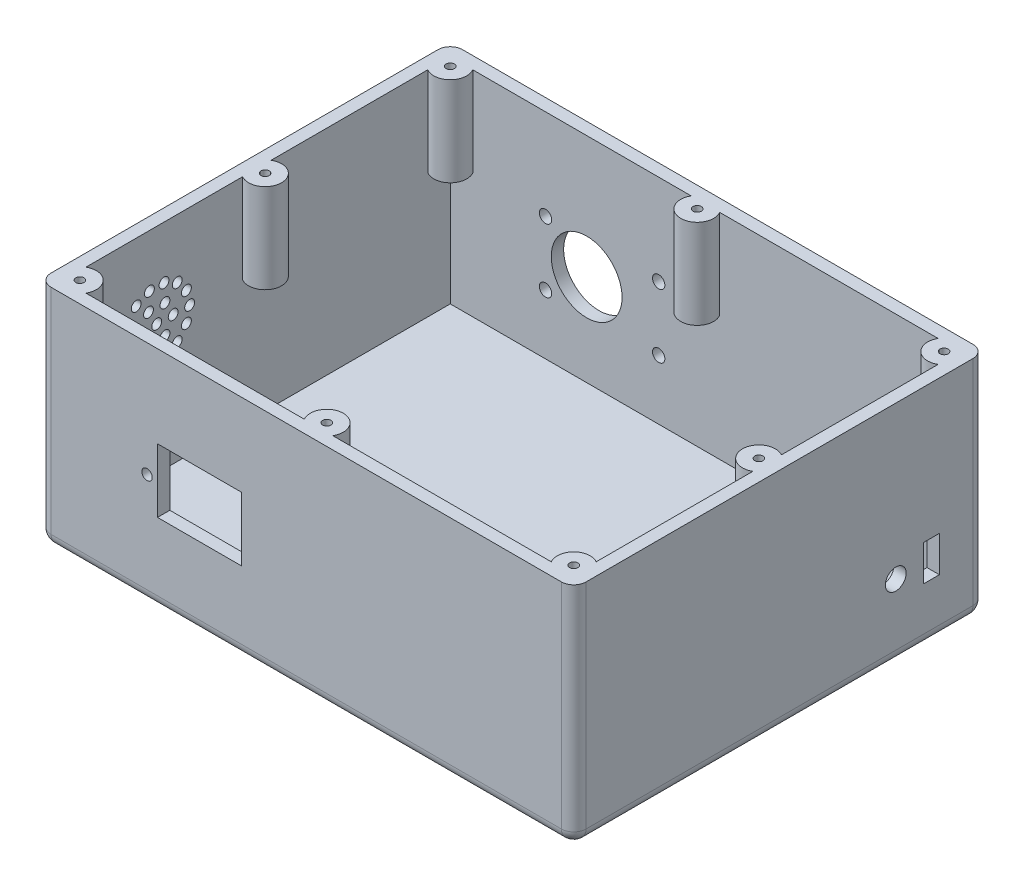
from build123d import *

# Parameters (mm, degrees)
SKETCH1_W                 = 130
SKETCH1_H                 = 100
BOSS_EXTRUDE1_DEPTH       = 55
F_1_0MM_DOWEL_HOLE1_D     = 2
F_1_0MM_DOWEL_HOLE1_DEPTH = 20
F_1_0MM_DOWEL_HOLE1_TIP   = 0.600860619
SHELL1_START              = 3
SHELL1_DEPTH              = 52
SHELL1_2_DEPTH            = 30.302681665
SKETCH4_R                 = 1.27
SKETCH4_W                 = 20.4
SKETCH4_H                 = 15.5
CUT_EXTRUDE1_DEPTH        = 10
SKETCH5_R                 = 8.6
SKETCH5_R_2               = 1.5
CUT_EXTRUDE5_DEPTH        = 10
SKETCH8_W                 = 3.9
SKETCH8_H                 = 8.7
CUT_EXTRUDE7_DEPTH        = 10
SKETCH13_R                = 2.53
CUT_EXTRUDE10_DEPTH       = 10
SKETCH15_R                = 1.2
CUT_EXTRUDE11_DEPTH       = 10
FILL_START                = -65
FILL_PATTERN1_OUTLINE_R   = 1.2
FILL_PATTERN1_DEPTH       = 3
FILLET3_R                 = 3


with BuildPart() as part:
    # Sketch1 → Boss-Extrude1 (new body)
    with BuildSketch(Plane(origin=(0, 0, 0), x_dir=(1, 0, 0), z_dir=(0, 1, 0))):
        Rectangle(SKETCH1_W, SKETCH1_H)
    extrude(amount=BOSS_EXTRUDE1_DEPTH)

    # Ø1.0mm Dowel Hole1
    with Locations(Plane(origin=(-60, 55, -45), x_dir=(0, 0, 1), z_dir=(0, 1, 0))):
        with Locations((0, 0), (45, 0), (90, 0), (90, 60), (90, 120), (45, 120), (0, 120), (0, 60)):
            Hole(F_1_0MM_DOWEL_HOLE1_D / 2, depth=F_1_0MM_DOWEL_HOLE1_DEPTH)
            with Locations((0, 0, -(F_1_0MM_DOWEL_HOLE1_DEPTH + F_1_0MM_DOWEL_HOLE1_TIP / 2))):  # 118° drill point
                Cone(0, F_1_0MM_DOWEL_HOLE1_D / 2, F_1_0MM_DOWEL_HOLE1_TIP, mode=Mode.SUBTRACT)

    # Shell1: read off the stored shape, not the designer's step
    # Shell1 outline → Shell1 (cut)
    with BuildSketch(Plane(origin=(0, 0, 0), x_dir=(1, 0, 0), z_dir=(0, 1, 0)).offset(SHELL1_START)):
        with BuildLine():
            Line((62, 3.464101615), (62, 41.535898385))
            ThreePointArc((62, 41.535898385), (57.171572875, 42.171572875), (56.535898385, 47))
            Line((56.535898385, 47), (3.464101615, 47))
            ThreePointArc((3.464101615, 47), (0, 41), (-3.464101615, 47))
            Line((-3.464101615, 47), (-56.535898385, 47))
            ThreePointArc((-56.535898385, 47), (-57.171572875, 42.171572875), (-62, 41.535898385))
            Line((-62, 41.535898385), (-62, 3.464101615))
            ThreePointArc((-62, 3.464101615), (-56, 0), (-62, -3.464101615))
            Line((-62, -3.464101615), (-62, -41.535898385))
            ThreePointArc((-62, -41.535898385), (-57.171572875, -42.171572875), (-56.535898385, -47))
            Line((-56.535898385, -47), (-3.464101615, -47))
            ThreePointArc((-3.464101615, -47), (0, -41), (3.464101615, -47))
            Line((3.464101615, -47), (56.535898385, -47))
            ThreePointArc((56.535898385, -47), (57.171572875, -42.171572875), (62, -41.535898385))
            Line((62, -41.535898385), (62, -3.464101615))
            ThreePointArc((62, -3.464101615), (56, 0), (62, 3.464101615))
        make_face()
    extrude(amount=SHELL1_DEPTH, mode=Mode.SUBTRACT)

    # Shell1 2 outline → Shell1 2 (cut)
    with BuildSketch(Plane(origin=(0, 0, 0), x_dir=(1, 0, 0), z_dir=(0, 1, 0)).offset(SHELL1_START)):
        with BuildLine():
            Line((62, 41.535898385), (62, 47))
            Line((62, 47), (56.535898385, 47))
            ThreePointArc((56.535898385, 47), (57.171572875, 42.171572875), (62, 41.535898385))
        make_face()
        with BuildLine():
            Line((62, -3.464101615), (62, 3.464101615))
            ThreePointArc((62, 3.464101615), (56, 0), (62, -3.464101615))
        make_face()
        with BuildLine():
            ThreePointArc((-3.464101615, 47), (0, 41), (3.464101615, 47))
            Line((3.464101615, 47), (-3.464101615, 47))
        make_face()
        with BuildLine():
            Line((62, -47), (62, -41.535898385))
            ThreePointArc((62, -41.535898385), (57.171572875, -42.171572875), (56.535898385, -47))
            Line((56.535898385, -47), (62, -47))
        make_face()
        with BuildLine():
            ThreePointArc((-62, 41.535898385), (-57.171572875, 42.171572875), (-56.535898385, 47))
            Line((-56.535898385, 47), (-62, 47))
            Line((-62, 47), (-62, 41.535898385))
        make_face()
        with BuildLine():
            Line((-3.464101615, -47), (3.464101615, -47))
            ThreePointArc((3.464101615, -47), (0, -41), (-3.464101615, -47))
        make_face()
        with BuildLine():
            ThreePointArc((-62, -3.464101615), (-56, 0), (-62, 3.464101615))
            Line((-62, 3.464101615), (-62, -3.464101615))
        make_face()
        with BuildLine():
            Line((-62, -47), (-56.535898385, -47))
            ThreePointArc((-56.535898385, -47), (-57.171572875, -42.171572875), (-62, -41.535898385))
            Line((-62, -41.535898385), (-62, -47))
        make_face()
    extrude(amount=SHELL1_2_DEPTH, mode=Mode.SUBTRACT)

    # Shell1 3 outline → Shell1 3 (revolve)
    with BuildSketch(Plane(origin=(-60, 0, -45), x_dir=(1, 0, 0), z_dir=(0, 0, 1))):
        Polygon((0, 33.302681665), (0, 30.899239189), (4, 33.302681665), align=None)
    revolve(axis=Axis((-60, 0, -45), (0, 1, 0)))

    # Shell1 4 outline → Shell1 4 (revolve)
    with BuildSketch(Plane(origin=(-60, 0, 45), x_dir=(1, 0, 0), z_dir=(0, 0, 1))):
        Polygon((0, 33.302681665), (0, 30.899239189), (4, 33.302681665), align=None)
    revolve(axis=Axis((-60, 0, 45), (0, 1, 0)))

    # Shell1 5 outline → Shell1 5 (revolve)
    with BuildSketch(Plane(origin=(60, 0, 45), x_dir=(1, 0, 0), z_dir=(0, 0, 1))):
        Polygon((0, 33.302681665), (0, 30.899239189), (4, 33.302681665), align=None)
    revolve(axis=Axis((60, 0, 45), (0, 1, 0)))

    # Shell1 6 outline → Shell1 6 (revolve)
    with BuildSketch(Plane(origin=(60, 0, -45), x_dir=(1, 0, 0), z_dir=(0, 0, 1))):
        Polygon((0, 33.302681665), (0, 30.899239189), (4, 33.302681665), align=None)
    revolve(axis=Axis((60, 0, -45), (0, 1, 0)))

    # Shell1 7 outline → Shell1 7 (revolve)
    with BuildSketch(Plane.XY.offset(-45)):
        Polygon((0, 33.302681684), (0, 30.899239189), (4.00000003, 33.302681684), align=None)
    revolve(axis=Axis((0, 0, -45), (0, 1, 0)))

    # Shell1 8 outline → Shell1 8 (revolve)
    with BuildSketch(Plane(origin=(60, 0, 0), x_dir=(1, 0, 0), z_dir=(0, 0, 1))):
        Polygon((0, 33.302681684), (0, 30.899239189), (4.00000003, 33.302681684), align=None)
    revolve(axis=Axis((60, 0, 0), (0, 1, 0)))

    # Shell1 9 outline → Shell1 9 (revolve)
    with BuildSketch(Plane.XY.offset(45)):
        Polygon((0, 33.302681684), (0, 30.899239189), (4.00000003, 33.302681684), align=None)
    revolve(axis=Axis((0, 0, 45), (0, 1, 0)))

    # Shell1 10 outline → Shell1 10 (revolve)
    with BuildSketch(Plane(origin=(-60, 0, 0), x_dir=(1, 0, 0), z_dir=(0, 0, 1))):
        Polygon((0, 33.302681684), (0, 30.899239189), (4.00000003, 33.302681684), align=None)
    revolve(axis=Axis((-60, 0, 0), (0, 1, 0)))

    # Sketch4 → Cut-Extrude1 (cut)
    with BuildSketch(Plane.XY.offset(50)):
        with Locations((-38.684925679, 27.25)):
            Circle(SKETCH4_R)
        with Locations((-25.944925679, 27.25)):
            Rectangle(SKETCH4_W, SKETCH4_H)
    extrude(amount=-CUT_EXTRUDE1_DEPTH, mode=Mode.SUBTRACT)

    # Sketch5 → Cut-Extrude5 (cut)
    with BuildSketch(Plane(origin=(0, 0, -50), x_dir=(-1, 0, 0), z_dir=(0, 0, -1))):
        with Locations((28.85677338, 25.25)):
            Circle(SKETCH5_R)
        with Locations((38.85677338, 33)):
            Circle(SKETCH5_R_2)
        with Locations((38.85677338, 17.5)):
            Circle(SKETCH5_R_2)
        with Locations((11.35677338, 17.5)):
            Circle(SKETCH5_R_2)
        with Locations((11.35677338, 33)):
            Circle(SKETCH5_R_2)
    extrude(amount=-CUT_EXTRUDE5_DEPTH, mode=Mode.SUBTRACT)

    # Sketch8 → Cut-Extrude7 (cut)
    with BuildSketch(Plane(origin=(65, 0, 0), x_dir=(0, 0, -1), z_dir=(1, 0, 0))):
        with Locations((36.894030088, 17.938163381)):
            Rectangle(SKETCH8_W, SKETCH8_H)
    extrude(amount=-CUT_EXTRUDE7_DEPTH, mode=Mode.SUBTRACT)

    # Sketch13 → Cut-Extrude10 (cut)
    with BuildSketch(Plane(origin=(65, 0, 0), x_dir=(0, 0, -1), z_dir=(1, 0, 0))):
        with Locations((28.256431713, 17.968393765)):
            Circle(SKETCH13_R)
    extrude(amount=-CUT_EXTRUDE10_DEPTH, mode=Mode.SUBTRACT)

    # Sketch15 → Cut-Extrude11 (cut)
    with BuildSketch(Plane.ZY.offset(65)):
        with Locations((24.332075027, 34.428640198)):
            Circle(SKETCH15_R)
    extrude(amount=-CUT_EXTRUDE11_DEPTH, mode=Mode.SUBTRACT)

    # Fill Pattern1: read off the stored shape, not the designer's step
    # Fill Pattern1 outline → Fill Pattern1 (cut)
    with BuildSketch(Plane.YZ.offset(FILL_START)):
        with Locations((34.428640198, 20.332075027)):
            Circle(FILL_PATTERN1_OUTLINE_R)
        with Locations((30.957570285, 17.124324084)):
            Circle(FILL_PATTERN1_OUTLINE_R)
        with Locations((28.173988339, 19.344156612)):
            Circle(FILL_PATTERN1_OUTLINE_R)
        with Locations((26.629216901, 22.551907556)):
            Circle(FILL_PATTERN1_OUTLINE_R)
        with Locations((40.683292058, 19.344156612)):
            Circle(FILL_PATTERN1_OUTLINE_R)
        with Locations((37.899710111, 17.124324084)):
            Circle(FILL_PATTERN1_OUTLINE_R)
        with Locations((34.428640198, 16.332075027)):
            Circle(FILL_PATTERN1_OUTLINE_R)
        with Locations((30.964538583, 22.332075027)):
            Circle(FILL_PATTERN1_OUTLINE_R)
        with Locations((30.964538583, 26.332075027)):
            Circle(FILL_PATTERN1_OUTLINE_R)
        with Locations((34.428640198, 28.332075027)):
            Circle(FILL_PATTERN1_OUTLINE_R)
        with Locations((37.892741814, 26.332075027)):
            Circle(FILL_PATTERN1_OUTLINE_R)
        with Locations((37.892741814, 22.332075027)):
            Circle(FILL_PATTERN1_OUTLINE_R)
        with Locations((42.228063496, 22.551907556)):
            Circle(FILL_PATTERN1_OUTLINE_R)
        with Locations((42.228063496, 26.112242499)):
            Circle(FILL_PATTERN1_OUTLINE_R)
        with Locations((40.683292058, 29.319993442)):
            Circle(FILL_PATTERN1_OUTLINE_R)
        with Locations((37.899710111, 31.539825971)):
            Circle(FILL_PATTERN1_OUTLINE_R)
        with Locations((34.428640198, 32.332075027)):
            Circle(FILL_PATTERN1_OUTLINE_R)
        with Locations((30.957570285, 31.539825971)):
            Circle(FILL_PATTERN1_OUTLINE_R)
        with Locations((28.173988339, 29.319993442)):
            Circle(FILL_PATTERN1_OUTLINE_R)
        with Locations((26.629216901, 26.112242499)):
            Circle(FILL_PATTERN1_OUTLINE_R)
    extrude(amount=FILL_PATTERN1_DEPTH, mode=Mode.SUBTRACT)

    # Fillet3
    fillet3_edges = [part.edges().sort_by_distance(p)[0] for p in [
        (0, 0, 50),
        (-65, 0, 0),
        (0, 0, -50),
        (65, 0, 0),
        (65, 27.5, 50),
        (-65, 27.5, 50),
        (-65, 27.5, -50),
        (65, 27.5, -50),
    ]]
    fillet(fillet3_edges, radius=FILLET3_R)


solid = part.part
